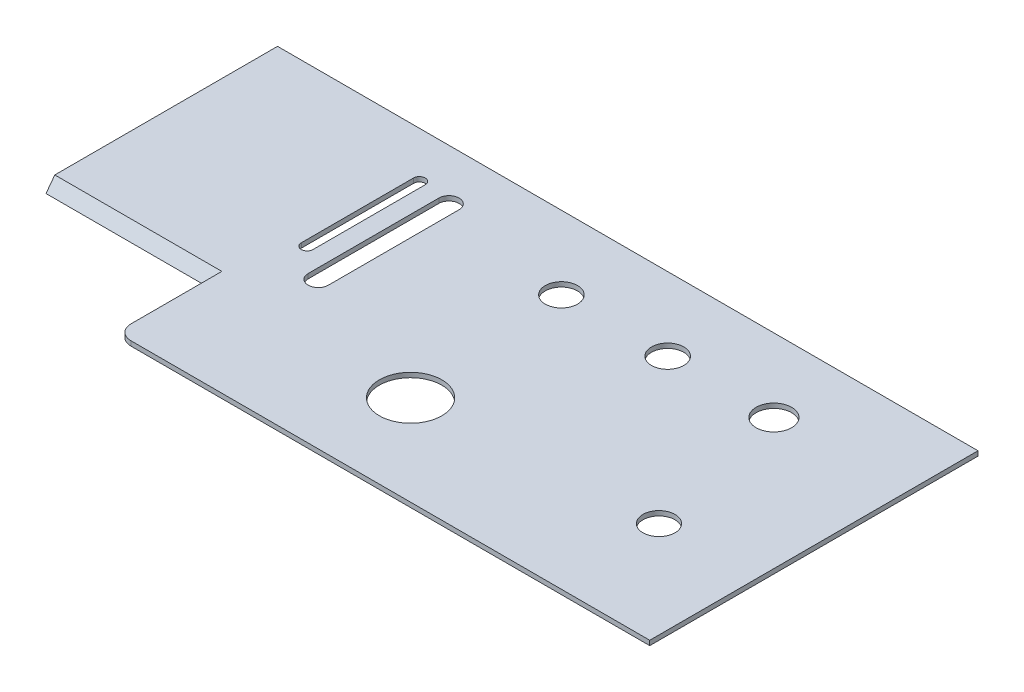
from build123d import *

# Parameters (mm, degrees)
SKETCH2_R           = 5.5
SKETCH2_R_2         = 6.05
SKETCH2_R_3         = 10.65
SKETCH2_R_4         = 5.45
BOSS_EXTRUDE1_DEPTH = 1.6
BOSS_EXTRUDE2_DEPTH = 57


with BuildPart() as part:
    # Sketch2 → Boss-Extrude1 (new body)
    with BuildSketch(Plane(origin=(0, 0, 0), x_dir=(1, 0, 0), z_dir=(0, 1, 0))):
        with BuildLine():
            Line((-90.572215876, -17.515500752), (-33.572215876, -17.515500752))
            Line((-33.572215876, -17.515500752), (-33.572215876, -48.515500752))
            ThreePointArc((-33.572215876, -48.515500752), (-32.107749781, -52.051034657), (-28.572215876, -53.515500752))
            Line((-28.572215876, -53.515500752), (148.427784124, -53.515500752))
            Line((148.427784124, -53.515500752), (148.427784124, 58.484499248))
            Line((148.427784124, 58.484499248), (-90.572215876, 58.484499248))
            Line((-90.572215876, 58.484499248), (-90.572215876, -17.515500752))
        make_face()
        with Locations((31.285988016, 33.484499248)):
            Circle(SKETCH2_R, mode=Mode.SUBTRACT)
        with Locations((67.535988016, 33.484499248)):
            Circle(SKETCH2_R, mode=Mode.SUBTRACT)
        with Locations((103.785988016, 33.484499248)):
            Circle(SKETCH2_R_2, mode=Mode.SUBTRACT)
        with Locations((35.977784124, -22.665500752)):
            Circle(SKETCH2_R_3, mode=Mode.SUBTRACT)
        with Locations((115.527784124, -17.465500752)):
            Circle(SKETCH2_R_4, mode=Mode.SUBTRACT)
        with BuildLine():
            Line((-28.472215876, 4.484499248), (-28.472215876, 42.784499248))
            ThreePointArc((-28.472215876, 42.784499248), (-26.472215876, 44.784499248), (-24.472215876, 42.784499248))
            Line((-24.472215876, 42.784499248), (-24.472215876, 4.484499248))
            ThreePointArc((-24.472215876, 4.484499248), (-26.472215876, 2.484499248), (-28.472215876, 4.484499248))
        make_face(mode=Mode.SUBTRACT)
        with BuildLine():
            Line((-11.322215876, 41.184499248), (-11.322215876, -3.415500752))
            ThreePointArc((-11.322215876, -3.415500752), (-14.772215876, -6.865500752), (-18.222215876, -3.415500752))
            Line((-18.222215876, -3.415500752), (-18.222215876, 41.184499248))
            ThreePointArc((-18.222215876, 41.184499248), (-14.772215876, 44.634499248), (-11.322215876, 41.184499248))
        make_face(mode=Mode.SUBTRACT)
    extrude(amount=BOSS_EXTRUDE1_DEPTH)

    # Sketch3 → Boss-Extrude2 (add)
    with BuildSketch(Plane.ZY.offset(33.572215876)):
        Polygon((17.515500752, 1.6), (20.515500752, -2.4), (17.515500752, -2.4), align=None)
    extrude(amount=BOSS_EXTRUDE2_DEPTH)


solid = part.part
